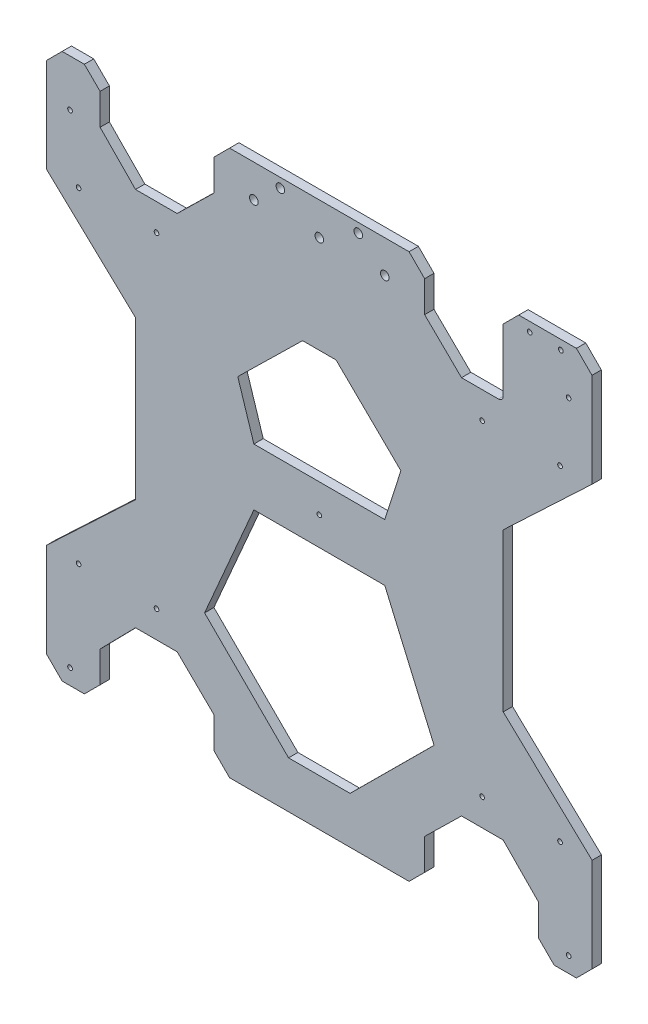
from build123d import *

# Parameters (mm, degrees)
SCHIZZO13_R                  = 1.5
SCHIZZO13_R_2                = 2.75
ESTRUSIONE_ESTRUSIONE2_DEPTH = 6


with BuildPart() as part:
    # Schizzo13 → Estrusione-Estrusione2 (new body)
    with BuildSketch(Plane.XY):
        with BuildLine():
            Line((9.919241786, 0), (24.201199756, 0))
            Line((24.201199756, 0), (34.201199756, 10))
            Line((34.201199756, 10), (34.28195797, 30))
            Line((34.28195797, 30), (57.017366293, 53.192694567))
            Line((57.017366293, 53.192694567), (83.745372993, 53.192694567))
            Line((83.745372993, 53.192694567), (107.404551383, 30))
            Line((107.404551383, 30), (107.404551383, 10))
            Line((107.404551383, 10), (117.404551383, 0))
            Line((117.404551383, 0), (232.595448617, 0))
            Line((232.595448617, 0), (242.595448617, 10))
            Line((242.595448617, 10), (242.595448617, 30))
            Line((242.595448617, 30), (266.254627007, 53.192694567))
            Line((266.254627007, 53.192694567), (292.982633707, 53.192694567))
            Line((292.982633707, 53.192694567), (315.71804203, 30))
            Line((315.71804203, 30), (315.71804203, 10))
            Line((315.71804203, 10), (325.71804203, 0))
            Line((325.71804203, 0), (340, 0))
            Line((340, 0), (350, 10))
            Line((350, 10), (350.080758214, 70.5))
            Line((350.080758214, 70.5), (293, 124.388863529))
            Line((293, 124.388863529), (293, 225.611136471))
            Line((293, 225.611136471), (350.080758214, 279.5))
            Line((350.080758214, 279.5), (350, 340))
            Line((350, 340), (340, 350))
            Line((340, 350), (302.982633707, 350))
            Line((302.982633707, 350), (292.982633707, 340))
            Line((292.982633707, 340), (292.982633707, 299.807305433))
            ThreePointArc((292.982633707, 299.807305433), (292.103954051, 297.685985089), (289.982633707, 296.807305433))
            Line((289.982633707, 296.807305433), (266.254627007, 296.807305433))
            Line((266.254627007, 296.807305433), (242.595448617, 320))
            Line((242.595448617, 320), (242.595448617, 340))
            Line((242.595448617, 340), (232.595448617, 350))
            Line((232.595448617, 350), (117.404551383, 350))
            Line((117.404551383, 350), (107.404551383, 340))
            Line((107.404551383, 340), (107.404551383, 320))
            Line((107.404551383, 320), (83.745372993, 296.807305433))
            Line((83.745372993, 296.807305433), (57.017366293, 296.807305433))
            Line((57.017366293, 296.807305433), (34.28195797, 320))
            Line((34.28195797, 320), (34.28195797, 340))
            Line((34.28195797, 340), (24.201199756, 350))
            Line((24.201199756, 350), (9.919241786, 350))
            Line((9.919241786, 350), (-0.080758214, 340))
            Line((-0.080758214, 340), (-0.080758214, 279.5))
            Line((-0.080758214, 279.5), (57, 225.611136471))
            Line((57, 225.611136471), (57, 175))
            Line((57, 175), (57, 124.388863529))
            Line((57, 124.388863529), (-0.080758214, 70.5))
            Line((-0.080758214, 70.5), (-0.080758214, 10))
            Line((-0.080758214, 10), (9.919241786, 0))
        make_face()
        with Locations((15, 320)):
            Circle(SCHIZZO13_R, mode=Mode.SUBTRACT)
        with Locations((20.5, 279.5)):
            Circle(SCHIZZO13_R, mode=Mode.SUBTRACT)
        with Locations((70.5, 279.5)):
            Circle(SCHIZZO13_R, mode=Mode.SUBTRACT)
        with Locations((175, 175)):
            Circle(SCHIZZO13_R, mode=Mode.SUBTRACT)
        with Locations((20.5, 70.5)):
            Circle(SCHIZZO13_R, mode=Mode.SUBTRACT)
        with Locations((200, 344)):
            Circle(SCHIZZO13_R_2, mode=Mode.SUBTRACT)
        with Locations((150, 344)):
            Circle(SCHIZZO13_R_2, mode=Mode.SUBTRACT)
        with Locations((175, 329)):
            Circle(SCHIZZO13_R_2, mode=Mode.SUBTRACT)
        with Locations((217, 329)):
            Circle(SCHIZZO13_R_2, mode=Mode.SUBTRACT)
        with Locations((133, 329)):
            Circle(SCHIZZO13_R_2, mode=Mode.SUBTRACT)
        with Locations((70.5, 70.5)):
            Circle(SCHIZZO13_R, mode=Mode.SUBTRACT)
        with Locations((279.5, 70.5)):
            Circle(SCHIZZO13_R, mode=Mode.SUBTRACT)
        with Locations((329.5, 70.5)):
            Circle(SCHIZZO13_R, mode=Mode.SUBTRACT)
        with Locations((335, 10)):
            Circle(SCHIZZO13_R, mode=Mode.SUBTRACT)
        with Locations((15, 10)):
            Circle(SCHIZZO13_R, mode=Mode.SUBTRACT)
        with Locations((279.5, 279.5)):
            Circle(SCHIZZO13_R, mode=Mode.SUBTRACT)
        with Locations((329.5, 279.5)):
            Circle(SCHIZZO13_R, mode=Mode.SUBTRACT)
        with Locations((335, 320)):
            Circle(SCHIZZO13_R, mode=Mode.SUBTRACT)
        with Locations((310, 344)):
            Circle(SCHIZZO13_R, mode=Mode.SUBTRACT)
        with Locations((330, 344)):
            Circle(SCHIZZO13_R, mode=Mode.SUBTRACT)
        Polygon((217, 193.286910978), (227.343033378, 225.611136471), (185.750894453, 266.383210572), (164.249105547, 266.383210572), (122.656966622, 225.611136471), (133, 193.286910978), align=None, mode=Mode.SUBTRACT)
        Polygon((133, 156.713089022), (101.348199345, 83.616789428), (155.254193112, 30), (194.745806888, 30), (248.651800655, 83.616789428), (217, 156.713089022), align=None, mode=Mode.SUBTRACT)
    extrude(amount=-ESTRUSIONE_ESTRUSIONE2_DEPTH)


solid = part.part
